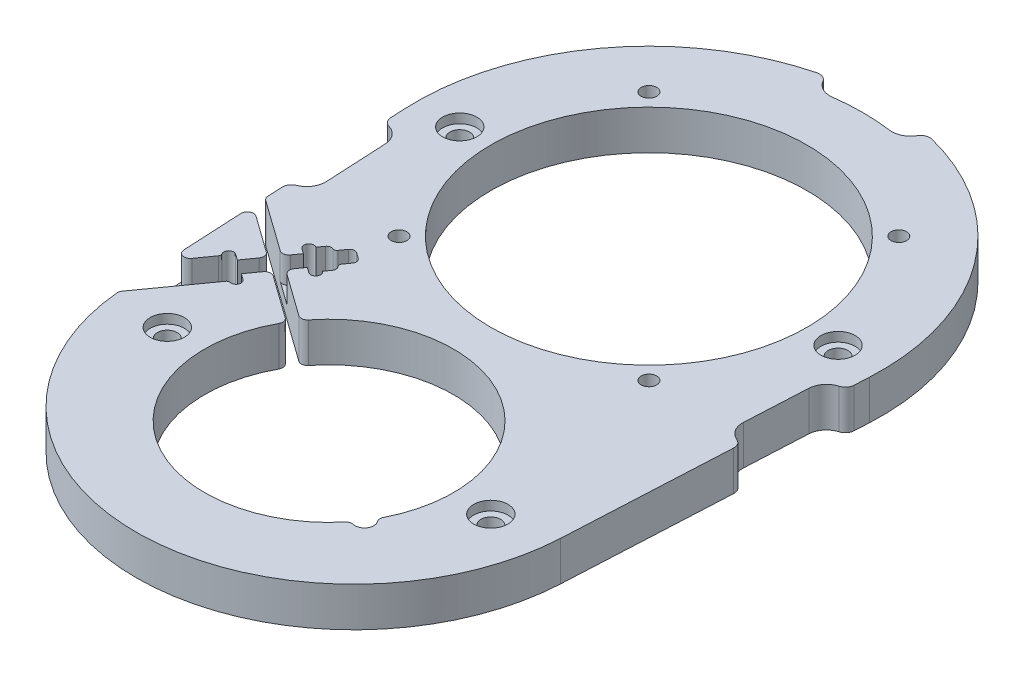
from build123d import *

# Parameters (mm, degrees)
SKETCH1_R           = 40
SKETCH1_R_2         = 50.8
SKETCH1_R_3         = 2.5
BOSS_EXTRUDE1_DEPTH = 12.7
CUT_EXTRUDE1_DEPTH  = 194.127134292
CUT_EXTRUDE2_DEPTH  = 8.5
CUT_EXTRUDE3_DEPTH  = 8.5
CUT_EXTRUDE4_DEPTH  = 194.127134292
CUT_EXTRUDE5_DEPTH  = 8.5
FILLET1_R           = 2
FILLET2_R           = 2
FILLET3_R           = 1.6
FILLET4_R           = 1
SKETCH10_R          = 3.175
CUT_EXTRUDE6_DEPTH  = 194.127134292
SKETCH11_R          = 3
CUT_EXTRUDE7_DEPTH  = 194.127134292
FILLET5_R           = 2
SKETCH12_R          = 5.5
CUT_EXTRUDE8_DEPTH  = 3
CUT_EXTRUDE9_DEPTH  = 194.12713443
FILLET6_R           = 3


with BuildPart() as part:
    # Sketch1 → Boss-Extrude1 (new body)
    with BuildSketch(Plane(origin=(0, 0, 0), x_dir=(1, 0, 0), z_dir=(0, 1, 0))):
        with BuildLine():
            Line((-74.704056398, 99.012658228), (-69.910213207, 4.455696203))
            ThreePointArc((-69.910213207, 4.455696203), (0, -62), (69.910213207, 4.455696203))
            Line((69.910213207, 4.455696203), (74.704056398, 99.012658228))
            ThreePointArc((74.704056398, 99.012658228), (0, 177.6), (-74.704056398, 99.012658228))
        make_face()
        with Locations(Location((0, 0, 0), (0, 0, 270))):
            Circle(SKETCH1_R, mode=Mode.SUBTRACT)
        with Locations(Location((0, 102.8, 0), (0, 0, 270))):
            Circle(SKETCH1_R_2, mode=Mode.SUBTRACT)
        with Locations(Location((40.163665171, 142.963665171, 0), (0, 0, 270))):
            Circle(SKETCH1_R_3, mode=Mode.SUBTRACT)
        with Locations(Location((40.163665171, 62.636334829, 0), (0, 0, 270))):
            Circle(SKETCH1_R_3, mode=Mode.SUBTRACT)
        with Locations(Location((-40.163665171, 62.636334829, 0), (0, 0, 270))):
            Circle(SKETCH1_R_3, mode=Mode.SUBTRACT)
        with Locations(Location((-40.163665171, 142.963665171, 0), (0, 0, 270))):
            Circle(SKETCH1_R_3, mode=Mode.SUBTRACT)
    extrude(amount=BOSS_EXTRUDE1_DEPTH)

    # Sketch3 → Cut-Extrude1 (cut, through all)
    with BuildSketch(Plane(origin=(0, 12.7, 0), x_dir=(1, 0, 0), z_dir=(0, 1, 0))):
        Polygon((0, 0), (-72.307134802, 51.734177215), (-74.169151375, 49.131698727), (-1.862016573, -2.602478489), align=None)
    extrude(amount=-CUT_EXTRUDE1_DEPTH, mode=Mode.SUBTRACT)

    # Sketch4 → Cut-Extrude2 (cut)
    with BuildSketch(Plane(origin=(0, 12.7, 0), x_dir=(1, 0, 0), z_dir=(0, 1, 0))):
        Polygon((-55.43094311, 35.72491958), (-72.445263355, 11.944571389), (-69.985011402, 5.93106572), (-50.957933208, 32.524578595), align=None)
    extrude(amount=-CUT_EXTRUDE2_DEPTH, mode=Mode.SUBTRACT)

    # Sketch5 → Cut-Extrude3 (cut)
    with BuildSketch(Plane(origin=(0, 12.7, 0), x_dir=(1, 0, 0), z_dir=(0, 1, 0))):
        Polygon((-50.957933208, 32.524578595), (-39.203953593, 48.952724054), (-43.676963495, 52.153065038), (-55.43094311, 35.72491958), align=None)
    extrude(amount=-CUT_EXTRUDE3_DEPTH, mode=Mode.SUBTRACT)

    # Sketch6 → Cut-Extrude4 (cut, through all)
    with BuildSketch(Plane(origin=(0, 12.7, 0), x_dir=(1, 0, 0), z_dir=(0, 1, 0))):
        with BuildLine():
            Line((-61.399034012, 31.387778703), (-53.136164811, 25.475876085))
            ThreePointArc((-53.136164811, 25.475876085), (-52.765933853, 23.243628554), (-54.998181384, 22.873397596))
            Line((-54.998181384, 22.873397596), (-57.209326064, 19.782954391))
            Line((-57.209326064, 19.782954391), (-65.472195265, 25.694857009))
            Line((-65.472195265, 25.694857009), (-63.261050585, 28.785300214))
            ThreePointArc((-63.261050585, 28.785300214), (-63.631281543, 31.017547745), (-61.399034012, 31.387778703))
        make_face()
        with BuildLine():
            Line((-48.253577172, 49.279546767), (-40.446141706, 43.693497049))
            Line((-40.446141706, 43.693497049), (-42.657286386, 40.603053844))
            ThreePointArc((-42.657286386, 40.603053844), (-42.287055428, 38.370806313), (-44.519302959, 38.000575355))
            Line((-44.519302959, 38.000575355), (-52.326738425, 43.586625073))
            ThreePointArc((-52.326738425, 43.586625073), (-52.696969382, 45.818872604), (-50.464721852, 46.189103562))
            Line((-50.464721852, 46.189103562), (-48.253577172, 49.279546767))
        make_face()
    extrude(amount=-CUT_EXTRUDE4_DEPTH, mode=Mode.SUBTRACT)

    # Sketch7 → Cut-Extrude5 (cut)
    with BuildSketch(Plane(origin=(0, 12.7, 0), x_dir=(1, 0, 0), z_dir=(0, 1, 0))):
        Polygon((-57.209326064, 19.782954391), (-69.762440014, 2.237885514), (-73.208758404, 10.192307077), (-70.622080139, 18.497034605), (-65.472195265, 25.694857009), align=None)
    extrude(amount=-CUT_EXTRUDE5_DEPTH, mode=Mode.SUBTRACT)

    # Fillet1
    fillet1_edges = [part.edges().sort_by_distance(p)[0] for p in [
        (-32.530981106, 6.35, -23.275207158),
        (-34.288731446, 6.35, -20.598128455),
        (-72.100144873, 6.35, -47.65136972),
        (-72.307134802, 6.35, -51.734177215),
    ]]
    fillet(fillet1_edges, radius=FILLET1_R)

    # Fillet2
    fillet2_edges = [part.edges().sort_by_distance(p)[0] for p in [
        (-70.622080139, 8.45, -18.497034605),
        (-69.762440014, 8.45, -2.237885514),
        (-55.43094311, 8.45, -35.72491958),
        (-50.957933208, 8.45, -32.524578595),
        (-53.568926538, 8.45, -38.327398068),
        (-49.095916635, 8.45, -35.127057084),
    ]]
    fillet(fillet2_edges, radius=FILLET2_R)

    # Fillet3
    fillet3_edges = [part.edges().sort_by_distance(p)[0] for p in [
        (-57.209326064, 2.1, -19.782954391),
        (-65.472195265, 2.1, -25.694857009),
        (-48.253577172, 6.35, -49.279546767),
        (-40.446141706, 6.35, -43.693497049),
        (-39.203953593, 8.45, -48.952724054),
        (-43.676963495, 8.45, -52.153065038),
    ]]
    fillet(fillet3_edges, radius=FILLET3_R)

    # Fillet4
    # the kernel refuses this fillet: 1 mm, written as the material it takes off along each edge
    with BuildSketch(Plane(origin=(-54.998181384, 14.7, -22.873397596), x_dir=(0.9115973776641382, 0, 0.41108420188066924), z_dir=(0, -1, 0))) as fillet4_piece_1:
        with BuildLine():
            CenterArc((0.823687768, 0.980580676), FILLET4_R, 191.309932474, 67.380135052)
            Line((-0.156892908, 0.784464541), (0, 0))
            ThreePointArc((0, 0), (0.313785816, 0.031070919), (0.627571632, 0))
        make_face()
    extrude(amount=16.7, mode=Mode.SUBTRACT)
    with BuildSketch(Plane(origin=(-63.261050585, 14.7, -28.785300214), x_dir=(-0.6833651940435568, 0, -0.7300767162222146), z_dir=(0, -1, 0))) as fillet4_piece_2:
        with BuildLine():
            CenterArc((0.823687768, -0.980580676), FILLET4_R, 101.309932474, 67.380135052)
            Line((-0.156892908, -0.784464541), (0, 0))
            ThreePointArc((0, 0), (0.313785816, -0.031070919), (0.627571632, 0))
        make_face()
    extrude(amount=16.7, mode=Mode.SUBTRACT)
    with BuildSketch(Plane(origin=(-42.113354488, 15.05290288, -44.886351416), x_dir=(0.5818801789556023, 0, -0.8132745276587705), z_dir=(0, -1, 0)), Plane(origin=(-46.58636439, 4.2, -48.0866924), x_dir=(0.5818801789556058, 0, -0.813274527658768), z_dir=(0, 1, 0))) as fillet4_piece_3:
        with BuildLine():
            CenterArc((0.941161152, 1), FILLET4_R, 192.212525269, 77.787474731)
            Line((-0.036208522, 0.788461538), (-0.133945489, 0.767307692))
            ThreePointArc((-0.133945489, 0.767307692), (-0.1, 0.45), (-0.1, 0))
            Line((-0.1, 0), (0, -0.1))
            Line((0, -0.1), (0.941161152, -0.1))
            Line((0.941161152, -0.1), (0.941161152, 0))
        make_face()
    extrude(amount=10.85290288, mode=Mode.SUBTRACT)

    # Sketch10 → Cut-Extrude6 (cut, through all)
    with BuildSketch(Plane(origin=(0, 12.7, 0), x_dir=(1, 0, 0), z_dir=(0, 1, 0))):
        with Locations(Location((-52, 0, 0), (0, 0, 270))):
            Circle(SKETCH10_R)
        with Locations(Location((-60.8, 102.8, 0), (0, 0, 270))):
            Circle(SKETCH10_R)
        with Locations(Location((60.8, 102.8, 0), (0, 0, 90))):
            Circle(SKETCH10_R)
        with Locations(Location((52, 0, 0), (0, 0, 90))):
            Circle(SKETCH10_R)
    extrude(amount=-CUT_EXTRUDE6_DEPTH, mode=Mode.SUBTRACT)

    # Sketch11 → Cut-Extrude7 (cut, through all)
    with BuildSketch(Plane(origin=(0, 12.7, 0), x_dir=(1, 0, 0), z_dir=(0, 1, 0))):
        with Locations((33.397146804, -22.01432682)):
            Circle(SKETCH11_R)
    extrude(amount=-CUT_EXTRUDE7_DEPTH, mode=Mode.SUBTRACT)

    # Fillet5
    fillet5_edges = [part.edges().sort_by_distance(p)[0] for p in [
        (34.95313052, 6.35, 19.449387313),
        (31.653304138, 6.35, 24.455435739),
    ]]
    fillet(fillet5_edges, radius=FILLET5_R)

    # Sketch12 → Cut-Extrude8 (cut)
    with BuildSketch(Plane(origin=(0, 12.7, 0), x_dir=(1, 0, 0), z_dir=(0, 1, 0))):
        with Locations(Location((-60.8, 102.8, 0), (0, 0, 270))):
            Circle(SKETCH12_R)
        with Locations(Location((60.8, 102.8, 0), (0, 0, 270))):
            Circle(SKETCH12_R)
        with Locations(Location((52, 0, 0), (0, 0, 270))):
            Circle(SKETCH12_R)
        with Locations(Location((-52, 0, 0), (0, 0, 270))):
            Circle(SKETCH12_R)
    extrude(amount=-CUT_EXTRUDE8_DEPTH, mode=Mode.SUBTRACT)

    # Sketch13 → Cut-Extrude9 (cut, through all)
    with BuildSketch(Plane(origin=(0, 12.7, 0), x_dir=(1, 0, 0), z_dir=(0, 1, 0))):
        with BuildLine():
            Line((-67.031392983, 66.171925083), (-68.044051211, 86.146271714))
            ThreePointArc((-68.044051211, 86.146271714), (-74.340152668, 91.834778235), (-80.028659189, 85.538676777))
            Line((-80.028659189, 85.538676777), (-79.016000961, 65.564330147))
            ThreePointArc((-79.016000961, 65.564330147), (-72.719899504, 59.875823626), (-67.031392983, 66.171925083))
        make_face()
        with BuildLine():
            Line((67.031392983, 66.171925083), (68.044051211, 86.146271714))
            ThreePointArc((68.044051211, 86.146271714), (74.340152668, 91.834778235), (80.028659189, 85.538676777))
            Line((80.028659189, 85.538676777), (79.016000961, 65.564330147))
            ThreePointArc((79.016000961, 65.564330147), (72.719899504, 59.875823626), (67.031392983, 66.171925083))
        make_face()
        with BuildLine():
            ThreePointArc((10.777978726, 182.877931883), (0, 183.6), (-10.777978726, 182.877931883))
            ThreePointArc((-10.777978726, 182.877931883), (-15.924014851, 176.131205847), (-9.177288816, 170.985169722))
            ThreePointArc((-9.177288816, 170.985169722), (0, 171.6), (9.177288816, 170.985169722))
            ThreePointArc((9.177288816, 170.985169722), (15.924014851, 176.131205847), (10.777978726, 182.877931883))
        make_face()
    extrude(amount=-CUT_EXTRUDE9_DEPTH, mode=Mode.SUBTRACT)

    # Fillet6
    fillet6_edges = [part.edges().sort_by_distance(p)[0] for p in [
        (-74.340152668, 6.35, -91.834778235),
        (-72.719899504, 6.35, -59.875823626),
        (74.340152668, 6.35, -91.834778235),
        (72.719899504, 6.35, -59.875823626),
        (-15.887130952, 6.35, -175.893358591),
        (15.887130952, 6.35, -175.893358591),
    ]]
    fillet(fillet6_edges, radius=FILLET6_R)


solid = part.part
